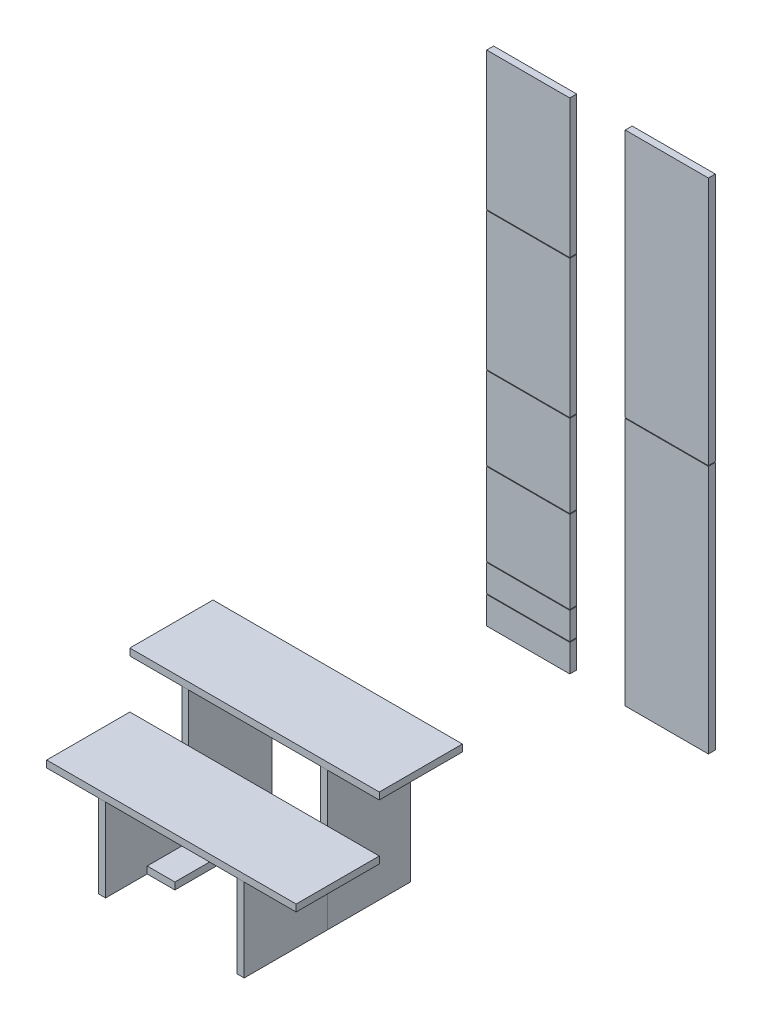
from build123d import *

# Parameters (mm, degrees)
SKETCH1_W               = 25.4
SKETCH1_H               = 304.8
BOSS_EXTRUDE1_DEPTH     = 508
BOSS_EXTRUDE1_2_DEPTH   = 508
SKETCH2_W               = 914.4
SKETCH2_H               = 304.8
BOSS_EXTRUDE2_DEPTH     = 25.4
SKETCH3_W               = 25.4
SKETCH3_H               = 304.8
BOSS_EXTRUDE3_DEPTH     = 304.8
BOSS_EXTRUDE3_2_DEPTH   = 304.8
SKETCH4_W               = 914.4
SKETCH4_H               = 304.8
BOSS_EXTRUDE4_DEPTH     = 25.4
SKETCH5_W               = 304.8
SKETCH5_H               = 25.4
BOSS_EXTRUDE5_DEPTH     = 1828.8
BOSS_EXTRUDE5_2_DEPTH   = 1828.8
SKETCH7_W               = 101.6
SKETCH7_H               = 304.8
BOSS_EXTRUDE6_DEPTH     = 25.4
BOSS_EXTRUDE6_2_DEPTH   = 25.4
SKETCH6_W               = 304.8
SKETCH6_H               = 2.54
CUT_EXTRUDE_THIN1_DEPTH = 25.4


with BuildPart() as part:
    # Sketch1 → Boss-Extrude1 (new body)
    with BuildSketch(Plane(origin=(0, 0, 0), x_dir=(1, 0, 0), z_dir=(0, 1, 0))):
        with Locations((-254, 0)):
            Rectangle(SKETCH1_W, SKETCH1_H)
    extrude(amount=BOSS_EXTRUDE1_DEPTH)


with BuildPart() as body_2:
    # Sketch1 → Boss-Extrude1 2 (new body)
    with BuildSketch(Plane(origin=(0, 0, 0), x_dir=(1, 0, 0), z_dir=(0, 1, 0))):
        with Locations((254, 0)):
            Rectangle(SKETCH1_W, SKETCH1_H)
    extrude(amount=BOSS_EXTRUDE1_2_DEPTH)


with BuildPart() as body_3:
    # Sketch2 → Boss-Extrude2 (new body)
    with BuildSketch(Plane(origin=(0, 508, 0), x_dir=(1, 0, 0), z_dir=(0, 1, 0))):
        Rectangle(SKETCH2_W, SKETCH2_H)
    extrude(amount=BOSS_EXTRUDE2_DEPTH)


with BuildPart() as body_4:
    # Sketch3 → Boss-Extrude3 (new body)
    with BuildSketch(Plane(origin=(0, 0, 0), x_dir=(1, 0, 0), z_dir=(0, 1, 0))):
        with Locations((-254, -304.8)):
            Rectangle(SKETCH3_W, SKETCH3_H)
    extrude(amount=BOSS_EXTRUDE3_DEPTH)


with BuildPart() as body_5:
    # Sketch3 → Boss-Extrude3 2 (new body)
    with BuildSketch(Plane(origin=(0, 0, 0), x_dir=(1, 0, 0), z_dir=(0, 1, 0))):
        with Locations((254, -304.8)):
            Rectangle(SKETCH3_W, SKETCH3_H)
    extrude(amount=BOSS_EXTRUDE3_2_DEPTH)


with BuildPart() as body_6:
    # Sketch4 → Boss-Extrude4 (new body)
    with BuildSketch(Plane(origin=(0, 304.8, 0), x_dir=(1, 0, 0), z_dir=(0, 1, 0))):
        with Locations((0, -304.8)):
            Rectangle(SKETCH4_W, SKETCH4_H)
    extrude(amount=BOSS_EXTRUDE4_DEPTH)


with BuildPart() as body_7:
    # Sketch5 → Boss-Extrude5 (new body)
    with BuildSketch(Plane(origin=(0, 0, 0), x_dir=(1, 0, 0), z_dir=(0, 1, 0))):
        with Locations((-254, 1117.6)):
            Rectangle(SKETCH5_W, SKETCH5_H)
    extrude(amount=BOSS_EXTRUDE5_DEPTH)


with BuildPart() as body_8:
    # Sketch5 → Boss-Extrude5 2 (new body)
    with BuildSketch(Plane(origin=(0, 0, 0), x_dir=(1, 0, 0), z_dir=(0, 1, 0))):
        with Locations((254, 1117.6)):
            Rectangle(SKETCH5_W, SKETCH5_H)
    extrude(amount=BOSS_EXTRUDE5_2_DEPTH)


with BuildPart() as body_9:
    # Sketch7 → Boss-Extrude6 (new body)
    with BuildSketch(Plane.XZ):
        with Locations((-190.5, 152.4)):
            Rectangle(SKETCH7_W, SKETCH7_H)
    extrude(amount=-BOSS_EXTRUDE6_DEPTH)


with BuildPart() as body_10:
    # Sketch7 → Boss-Extrude6 2 (new body)
    with BuildSketch(Plane.XZ):
        with Locations((190.5, 152.4)):
            Rectangle(SKETCH7_W, SKETCH7_H)
    extrude(amount=-BOSS_EXTRUDE6_2_DEPTH)


with BuildPart() as cut_extrude_thin1_tool:
    # Sketch6 → Cut-Extrude-Thin1 (new body)
    with BuildSketch(Plane(origin=(0, 0, -1130.3), x_dir=(-1, 0, 0), z_dir=(0, 0, -1))):
        with Locations((-254, 914.4)):
            Rectangle(SKETCH6_W, SKETCH6_H)
        with Locations((254, 1320.8)):
            Rectangle(SKETCH6_W, SKETCH6_H)
        with Locations((254, 812.8)):
            Rectangle(SKETCH6_W, SKETCH6_H)
        with Locations((254, 508)):
            Rectangle(SKETCH6_W, SKETCH6_H)
        with Locations((254, 203.2)):
            Rectangle(SKETCH6_W, SKETCH6_H)
        with Locations((254, 101.6)):
            Rectangle(SKETCH6_W, SKETCH6_H)
    extrude(amount=-CUT_EXTRUDE_THIN1_DEPTH)


with BuildPart() as body_7_1:
    add(body_7.part)

    # Cut-Extrude-Thin1: cut by cut_extrude_thin1_tool
    add(cut_extrude_thin1_tool.part, mode=Mode.SUBTRACT)


with BuildPart() as body_8_1:
    add(body_8.part)

    # Cut-Extrude-Thin1: cut by cut_extrude_thin1_tool
    add(cut_extrude_thin1_tool.part, mode=Mode.SUBTRACT)


with BuildPart() as cut_extrude_thin1_piece_1:
    # of the separate pieces the step leaves, piece 1, a body of its own (cut_extrude_thin1_pieces)
    add(body_7_1.part.solids().sort_by_distance((-406.4, 1322.07, -1130.3))[0])


with BuildPart() as cut_extrude_thin1_piece_2:
    # of the separate pieces the step leaves, piece 2, a body of its own (cut_extrude_thin1_pieces)
    add(body_7_1.part.solids().sort_by_distance((-406.4, 814.07, -1130.3))[0])


with BuildPart() as cut_extrude_thin1_piece_3:
    # of the separate pieces the step leaves, piece 3, a body of its own (cut_extrude_thin1_pieces)
    add(body_7_1.part.solids().sort_by_distance((-406.4, 204.47, -1130.3))[0])


with BuildPart() as cut_extrude_thin1_piece_4:
    # of the separate pieces the step leaves, piece 4, a body of its own (cut_extrude_thin1_pieces)
    add(body_7_1.part.solids().sort_by_distance((-406.4, 509.27, -1130.3))[0])


with BuildPart() as cut_extrude_thin1_piece_5:
    # of the separate pieces the step leaves, piece 5, a body of its own (cut_extrude_thin1_pieces)
    add(body_7_1.part.solids().sort_by_distance((-406.4, 0, -1130.3))[0])


with BuildPart() as cut_extrude_thin1_piece_6:
    # of the separate pieces the step leaves, piece 6, a body of its own (cut_extrude_thin1_pieces)
    add(body_7_1.part.solids().sort_by_distance((-406.4, 102.87, -1130.3))[0])


with BuildPart() as cut_extrude_thin1_piece_1_of_body_8:
    # of the separate pieces the step leaves, piece 1, a body of its own (cut_extrude_thin1_pieces_of_body_8)
    add(body_8_1.part.solids().sort_by_distance((101.6, 0, -1130.3))[0])


with BuildPart() as cut_extrude_thin1_piece_2_of_body_8:
    # of the separate pieces the step leaves, piece 2, a body of its own (cut_extrude_thin1_pieces_of_body_8)
    add(body_8_1.part.solids().sort_by_distance((101.6, 915.67, -1130.3))[0])


solid = Compound([part.part, body_2.part, body_3.part, body_4.part, body_5.part, body_6.part, body_9.part, body_10.part, cut_extrude_thin1_piece_1.part, cut_extrude_thin1_piece_2.part, cut_extrude_thin1_piece_3.part, cut_extrude_thin1_piece_4.part, cut_extrude_thin1_piece_5.part, cut_extrude_thin1_piece_6.part, cut_extrude_thin1_piece_1_of_body_8.part, cut_extrude_thin1_piece_2_of_body_8.part])
